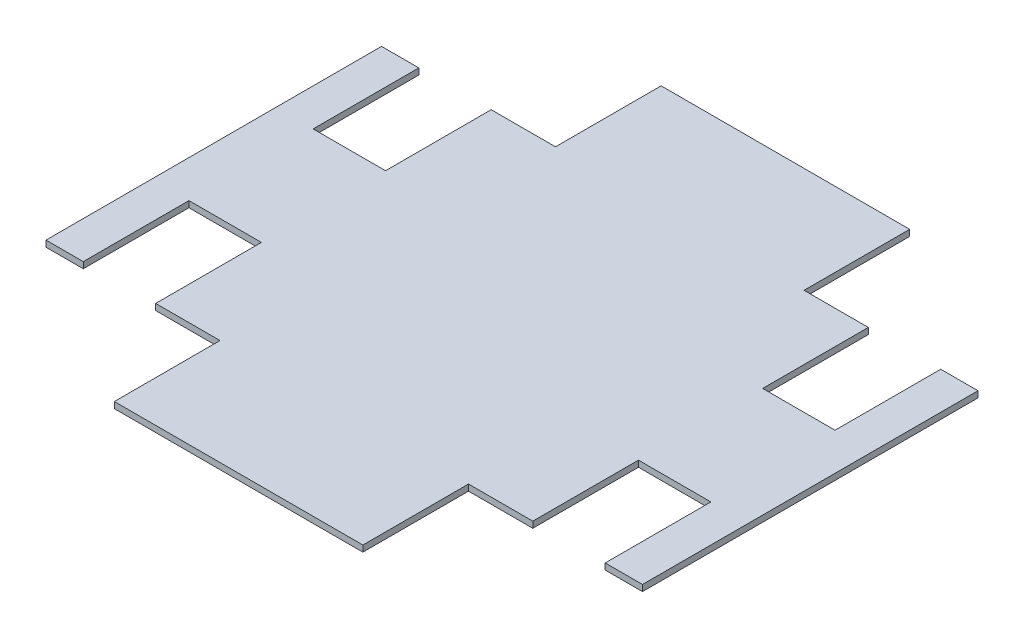
from build123d import *

# Parameters (mm, degrees)
BOSS_EXTRUDE1_DEPTH = 3.175


with BuildPart() as part:
    # Sketch1 → Boss-Extrude1 (new body)
    with BuildSketch(Plane(origin=(0, 0, 0), x_dir=(1, 0, 0), z_dir=(0, 1, 0))):
        Polygon((152.4, -85.725), (152.4, 85.725), (133.35, 85.725), (133.35, 31.725), (96.35, 31.725), (96.35, 85.725), (63.5, 85.725), (63.5, 139.7), (-63.5, 139.7), (-63.5, 85.725), (-96.35, 85.725), (-96.35, 31.725), (-133.35, 31.725), (-133.35, 85.725), (-152.4, 85.725), (-152.4, -85.725), (-133.35, -85.725), (-133.35, -31.725), (-96.35, -31.725), (-96.35, -85.725), (-63.5, -85.725), (-63.5, -139.7), (63.5, -139.7), (63.5, -85.725), (96.35, -85.725), (96.35, -31.725), (133.35, -31.725), (133.35, -85.725), align=None)
    extrude(amount=BOSS_EXTRUDE1_DEPTH)


solid = part.part
